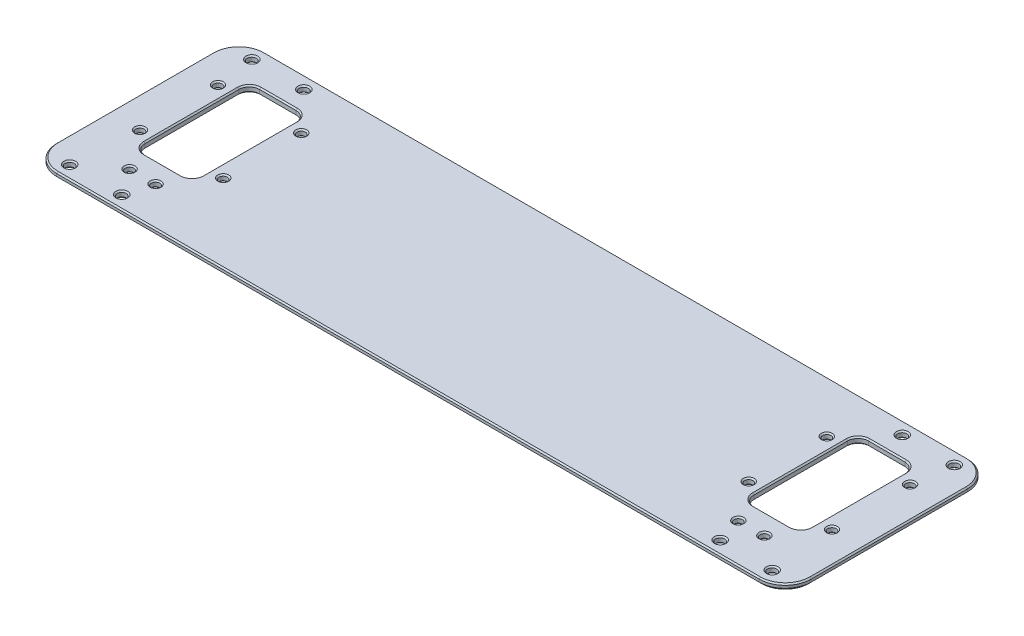
from build123d import *

# Parameters (mm, degrees)
SKETCH1_W           = 368.3
SKETCH1_H           = 101.6
SKETCH1_R           = 2.032
SKETCH1_R_2         = 2.2225
SKETCH1_W_2         = 27.94
SKETCH1_H_2         = 55.88
BOSS_EXTRUDE1_DEPTH = 3.175
FILLET1_R           = 5.08
FILLET2_R           = 5.08
FILLET3_R           = 12.7
CHAMFER3_SIZE       = 0.635
CHAMFER4_SIZE       = 1.27
CHAMFER5_SIZE       = 0.635
CHAMFER6_SIZE       = 0.635
CHAMFER7_SIZE       = 0.635
CHAMFER8_SIZE       = 0.635


with BuildPart() as part:
    # Sketch1 → Boss-Extrude1 (new body)
    with BuildSketch(Plane(origin=(0, 0, 0), x_dir=(1, 0, 0), z_dir=(0, 1, 0))):
        Rectangle(SKETCH1_W, SKETCH1_H)
        with Locations((-128.27, 25.4)):
            Circle(SKETCH1_R, mode=Mode.SUBTRACT)
        with Locations((-128.27, -12.7)):
            Circle(SKETCH1_R, mode=Mode.SUBTRACT)
        with Locations((-168.91, 25.4)):
            Circle(SKETCH1_R, mode=Mode.SUBTRACT)
        with Locations((-168.91, -12.7)):
            Circle(SKETCH1_R, mode=Mode.SUBTRACT)
        with Locations((168.91, 25.4)):
            Circle(SKETCH1_R, mode=Mode.SUBTRACT)
        with Locations((128.27, 25.4)):
            Circle(SKETCH1_R, mode=Mode.SUBTRACT)
        with Locations((128.27, -12.7)):
            Circle(SKETCH1_R, mode=Mode.SUBTRACT)
        with Locations((168.91, -12.7)):
            Circle(SKETCH1_R, mode=Mode.SUBTRACT)
        with Locations((171.45, -44.45)):
            Circle(SKETCH1_R_2, mode=Mode.SUBTRACT)
        with Locations((146.05, -44.45)):
            Circle(SKETCH1_R_2, mode=Mode.SUBTRACT)
        with Locations((171.45, 44.45)):
            Circle(SKETCH1_R_2, mode=Mode.SUBTRACT)
        with Locations((146.05, 44.45)):
            Circle(SKETCH1_R_2, mode=Mode.SUBTRACT)
        with Locations((-146.05, -44.45)):
            Circle(SKETCH1_R_2, mode=Mode.SUBTRACT)
        with Locations((-171.45, -44.45)):
            Circle(SKETCH1_R_2, mode=Mode.SUBTRACT)
        with Locations((-146.05, 44.45)):
            Circle(SKETCH1_R_2, mode=Mode.SUBTRACT)
        with Locations((-171.45, 44.45)):
            Circle(SKETCH1_R_2, mode=Mode.SUBTRACT)
        with Locations((142.24, -31.75)):
            Circle(SKETCH1_R, mode=Mode.SUBTRACT)
        with Locations((154.94, -31.75)):
            Circle(SKETCH1_R, mode=Mode.SUBTRACT)
        with Locations((-154.94, -31.75)):
            Circle(SKETCH1_R, mode=Mode.SUBTRACT)
        with Locations((-142.24, -31.75)):
            Circle(SKETCH1_R, mode=Mode.SUBTRACT)
        with Locations((-148.59, 6.35)):
            Rectangle(SKETCH1_W_2, SKETCH1_H_2, mode=Mode.SUBTRACT)
        with Locations((148.59, 6.35)):
            Rectangle(SKETCH1_W_2, SKETCH1_H_2, mode=Mode.SUBTRACT)
    extrude(amount=BOSS_EXTRUDE1_DEPTH)

    # Fillet1
    fillet1_edges = [part.edges().sort_by_distance(p)[0] for p in [
        (-134.62, 1.5875, 21.59),
        (-162.56, 1.5875, 21.59),
        (-162.56, 1.5875, -34.29),
        (-134.62, 1.5875, -34.29),
    ]]
    fillet(fillet1_edges, radius=FILLET1_R)

    # Fillet2
    fillet2_edges = [part.edges().sort_by_distance(p)[0] for p in [
        (162.56, 1.5875, 21.59),
        (134.62, 1.5875, 21.59),
        (134.62, 1.5875, -34.29),
        (162.56, 1.5875, -34.29),
    ]]
    fillet(fillet2_edges, radius=FILLET2_R)

    # Fillet3
    fillet3_edges = [part.edges().sort_by_distance(p)[0] for p in [
        (184.15, 1.5875, 50.8),
        (184.15, 1.5875, -50.8),
        (-184.15, 1.5875, 50.8),
        (-184.15, 1.5875, -50.8),
    ]]
    fillet(fillet3_edges, radius=FILLET3_R)

    # Chamfer3
    chamfer3_edges = [part.edges().sort_by_distance(p)[0] for p in [
        (161.072102448, 3.175, -32.802102448),
        (148.59, 3.175, -34.29),
        (136.107897552, 3.175, -32.802102448),
        (162.56, 3.175, -6.35),
        (161.072102448, 3.175, 20.102102448),
        (148.59, 3.175, 21.59),
        (136.107897552, 3.175, 20.102102448),
        (134.62, 3.175, -6.35),
        (136.107897552, 0, -32.802102448),
        (148.59, 0, -34.29),
        (161.072102448, 0, -32.802102448),
        (162.56, 0, -6.35),
        (161.072102448, 0, 20.102102448),
        (148.59, 0, 21.59),
        (136.107897552, 0, 20.102102448),
        (134.62, 0, -6.35),
        (-136.107897552, 3.175, 20.102102448),
        (-148.59, 3.175, 21.59),
        (-134.62, 3.175, -6.35),
        (-136.107897552, 3.175, -32.802102448),
        (-148.59, 3.175, -34.29),
        (-161.072102448, 3.175, 20.102102448),
        (-161.072102448, 3.175, -32.802102448),
        (-162.56, 3.175, -6.35),
        (-136.107897552, 0, 20.102102448),
        (-148.59, 0, 21.59),
        (-134.62, 0, -6.35),
        (-136.107897552, 0, -32.802102448),
        (-148.59, 0, -34.29),
        (-161.072102448, 0, 20.102102448),
        (-162.56, 0, -6.35),
        (-161.072102448, 0, -32.802102448),
    ]]
    chamfer(chamfer3_edges, length=CHAMFER3_SIZE)

    # Chamfer4
    chamfer4_edges = [part.edges().sort_by_distance(p)[0] for p in [
        (180.430256121, 0, -47.080256121),
        (0, 0, -50.8),
        (-180.430256121, 0, -47.080256121),
        (-184.15, 0, 0),
        (-180.430256121, 0, 47.080256121),
        (0, 0, 50.8),
        (180.430256121, 0, 47.080256121),
        (184.15, 0, 0),
    ]]
    chamfer(chamfer4_edges, length=CHAMFER4_SIZE)

    # Chamfer5
    chamfer5_edges = [part.edges().sort_by_distance(p)[0] for p in [
        (-170.942, 0, 12.7),
        (-170.942, 0, -25.4),
        (-130.302, 0, -25.4),
        (-130.302, 0, 12.7),
        (166.878, 0, 12.7),
        (166.878, 0, -25.4),
        (126.238, 0, 12.7),
        (126.238, 0, -25.4),
        (-173.6725, 0, -44.45),
        (-148.2725, 0, -44.45),
        (-148.2725, 0, 44.45),
        (-173.6725, 0, 44.45),
        (143.8275, 0, 44.45),
        (169.2275, 0, 44.45),
        (143.8275, 0, -44.45),
        (169.2275, 0, -44.45),
    ]]
    chamfer(chamfer5_edges, length=CHAMFER5_SIZE)

    # Chamfer6
    chamfer6_edges = [part.edges().sort_by_distance(p)[0] for p in [
        (180.430256121, 3.175, 47.080256121),
        (184.15, 3.175, 0),
        (180.430256121, 3.175, -47.080256121),
        (0, 3.175, 50.8),
        (-180.430256121, 3.175, 47.080256121),
        (-184.15, 3.175, 0),
        (0, 3.175, -50.8),
        (-180.430256121, 3.175, -47.080256121),
    ]]
    chamfer(chamfer6_edges, length=CHAMFER6_SIZE)

    # Chamfer7
    chamfer7_edges = [part.edges().sort_by_distance(p)[0] for p in [
        (-170.942, 3.175, 12.7),
        (-170.942, 3.175, -25.4),
        (-130.302, 3.175, -25.4),
        (-130.302, 3.175, 12.7),
        (126.238, 3.175, 12.7),
        (126.238, 3.175, -25.4),
        (166.878, 3.175, -25.4),
        (166.878, 3.175, 12.7),
        (143.8275, 3.175, -44.45),
        (169.2275, 3.175, -44.45),
        (143.8275, 3.175, 44.45),
        (169.2275, 3.175, 44.45),
        (-148.2725, 3.175, -44.45),
        (-173.6725, 3.175, -44.45),
        (-173.6725, 3.175, 44.45),
        (-148.2725, 3.175, 44.45),
    ]]
    chamfer(chamfer7_edges, length=CHAMFER7_SIZE)

    # Chamfer8
    chamfer8_edges = [part.edges().sort_by_distance(p)[0] for p in [
        (-156.972, 0, 31.75),
        (-144.272, 0, 31.75),
        (152.908, 0, 31.75),
        (140.208, 0, 31.75),
        (152.908, 3.175, 31.75),
        (140.208, 3.175, 31.75),
        (-156.972, 3.175, 31.75),
        (-144.272, 3.175, 31.75),
    ]]
    chamfer(chamfer8_edges, length=CHAMFER8_SIZE)


solid = part.part
